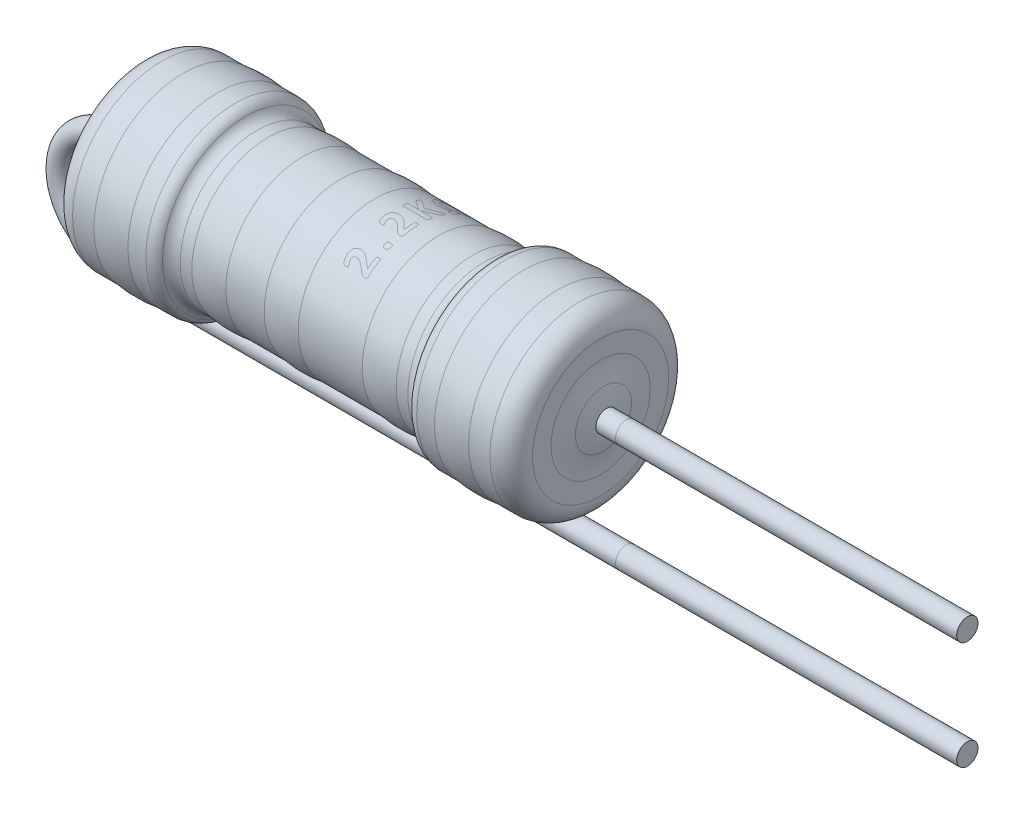
from build123d import *

# Parameters (mm, degrees)
SKETCH_WIRE_DIAMETER_R = 0.25
FILLET1_R              = 0.3
FILLET2_R              = 2


with BuildPart() as part:
    # SET WIRE LENGTH: sweep along a path in Sketch Set Wire Width
    with BuildLine(Plane.XY) as set_wire_length_path:
        Line((14.01017733, 0), (6, 0))
        Line((6, 0), (0, 0))
        Line((0, 0), (-6, 0))
        ThreePointArc((-6, 0), (-7.27, -1.27), (-6, -2.54))
        Line((-6, -2.54), (6, -2.54))
        Line((6, -2.54), (14.01017733, -2.54))
    # Sketch Wire Diameter → SET WIRE LENGTH (sweep)
    with BuildSketch(Plane(origin=(0, 0, 0), x_dir=(0, 0, -1), z_dir=(1, 0, 0))):
        Circle(SKETCH_WIRE_DIAMETER_R)
    sweep(path=set_wire_length_path.line)


with BuildPart() as body_2:
    # Sketch3 → Revolve2 (revolve)
    with BuildSketch(Plane.XY):
        with BuildLine():
            Line((-5.4, 0), (5.4, 0))
            Line((5.4, 0), (5.4, 1.6))
            ThreePointArc((5.4, 1.6), (5.253553391, 1.953553391), (4.9, 2.1))
            Line((4.9, 2.1), (3.18, 2.1))
            ThreePointArc((3.18, 2.1), (2.982010101, 2.017989899), (2.9, 1.82))
            Line((2.9, 1.82), (2.9, 1.8))
            Line((2.9, 1.8), (-2.9, 1.8))
            Line((-2.9, 1.8), (-2.9, 1.82))
            ThreePointArc((-2.9, 1.82), (-2.982010101, 2.017989899), (-3.18, 2.1))
            Line((-3.18, 2.1), (-4.9, 2.1))
            ThreePointArc((-4.9, 2.1), (-5.253553391, 1.953553391), (-5.4, 1.6))
            Line((-5.4, 1.6), (-5.4, 0))
        make_face()
    revolve(axis=Axis((-5.4, 0, 0), (1, 0, 0)))

    # Fillet1
    fillet1_edges = [body_2.edges().sort_by_distance(p)[0] for p in [
        (2.9, -1.8, 0),
        (-2.9, -1.8, 0),
    ]]
    fillet(fillet1_edges, radius=FILLET1_R)

    # Sketch5 → Band 1 (revolve)
    with BuildSketch(Plane.XY):
        with BuildLine():
            Line((-4.4, 2.1), (-3.6, 2.1))
            ThreePointArc((-3.6, 2.1), (-4, 2.13), (-4.4, 2.1))
        make_face()
    revolve(axis=Axis((-0.3, 0, 0), (-1, 0, 0)))

    # Sketch8 → Band 2 (revolve)
    with BuildSketch(Plane.XY):
        with BuildLine():
            Line((-2.4, 1.8), (-1.6, 1.8))
            ThreePointArc((-1.6, 1.8), (-2, 1.83), (-2.4, 1.8))
        make_face()
    revolve(axis=Axis((-0.3, 0, 0), (-1, 0, 0)))

    # Sketch9 → Band 3 (revolve)
    with BuildSketch(Plane.XY):
        with BuildLine():
            Line((-0.7, 1.8), (0.1, 1.8))
            ThreePointArc((0.1, 1.8), (-0.3, 1.83), (-0.7, 1.8))
        make_face()
    revolve(axis=Axis((-0.3, 0, 0), (-1, 0, 0)))

    # Sketch10 → Band 4 (revolve)
    with BuildSketch(Plane.XY):
        with BuildLine():
            Line((1.6, 1.8), (2.4, 1.8))
            ThreePointArc((2.4, 1.8), (2, 1.83), (1.6, 1.8))
        make_face()
    revolve(axis=Axis((0, 0, 0), (1, 0, 0)))

    # Sketch11 → Band 5 (revolve)
    with BuildSketch(Plane.XY):
        with BuildLine():
            Line((3.6, 2.1), (4.4, 2.1))
            ThreePointArc((4.4, 2.1), (4, 2.13), (3.6, 2.1))
        make_face()
    revolve(axis=Axis((2, 0, 0), (1, 0, 0)))

    # Sketch12 → Revolve10 (revolve)
    with BuildSketch(Plane.XY):
        with BuildLine():
            Line((-5.35, 1), (-5.35, 0))
            Line((-5.35, 0), (-5.55, 0))
            ThreePointArc((-5.55, 0), (-5.499509757, 0.509901951), (-5.35, 1))
        make_face()
        with BuildLine():
            Line((5.35, 1), (5.35, 0))
            Line((5.35, 0), (5.55, 0))
            ThreePointArc((5.55, 0), (5.499509757, 0.509901951), (5.35, 1))
        make_face()
    revolve(axis=Axis((-5.35, 0, 0), (1, 0, 0)))

    # Fillet2
    fillet2_edges = [body_2.edges().sort_by_distance(p)[0] for p in [
        (5.4, -0.870344759, 0),
        (-5.4, -0.870344759, 0),
    ]]
    fillet(fillet2_edges, radius=FILLET2_R)


solid = Compound([part.part, body_2.part])
